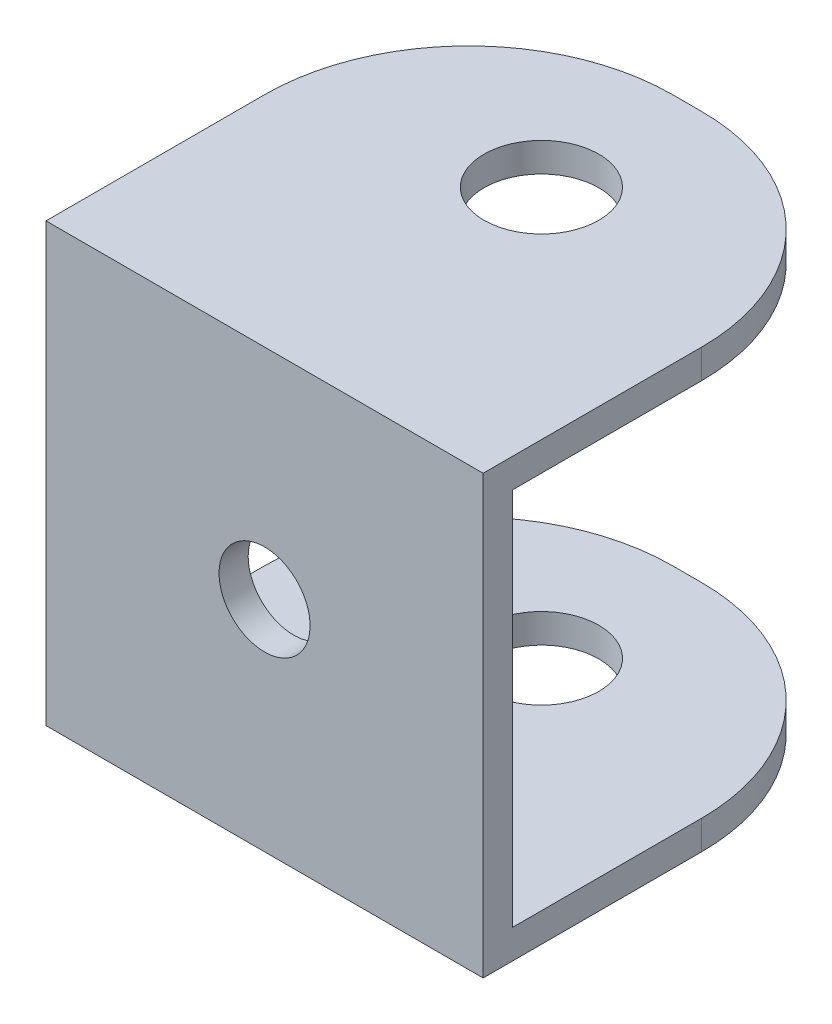
from build123d import *

# Parameters (mm, degrees)
SKETCH2_W                      = 38.1
SKETCH2_H                      = 38.1
BOSS_EXTRUDE1_DEPTH            = 2.54
F_5_16_0_3125_DIAMETER_HOLE1_D = 7.9375
BOSS_EXTRUDE2_DEPTH            = 2.54
F_10_0MM_DOWEL_HOLE1_D         = 10


with BuildPart() as part:
    # Sketch2 → Boss-Extrude1 (new body)
    with BuildSketch(Plane.XY):
        with Locations((19.05, 19.05)):
            Rectangle(SKETCH2_W, SKETCH2_H)
    boss_extrude1 = extrude(amount=BOSS_EXTRUDE1_DEPTH)

    # 5/16 (0.3125) Diameter Hole1 (through all)
    with Locations(Plane(origin=(19.05, 19.05, 0), x_dir=(-1, 0, 0), z_dir=(0, 0, -1))):
        with Locations((0, 0)):
            f_5_16_0_3125_diameter_hole1 = Hole(F_5_16_0_3125_DIAMETER_HOLE1_D / 2)

    # Sketch4 → Boss-Extrude2 (add)
    with BuildSketch(Plane(origin=(0, 38.1, 0), x_dir=(1, 0, 0), z_dir=(0, 1, 0))):
        with BuildLine():
            Line((0, 0), (0, 16.51))
            ThreePointArc((0, 16.51), (5.207641431, 29.082358569), (17.78, 34.29))
            Line((17.78, 34.29), (20.32, 34.29))
            ThreePointArc((20.32, 34.29), (32.892358569, 29.082358569), (38.1, 16.51))
            Line((38.1, 16.51), (38.1, 0))
            Line((38.1, 0), (38.1, -2.54))
            Line((38.1, -2.54), (0, -2.54))
            Line((0, -2.54), (0, 0))
        make_face()
    boss_extrude2 = extrude(amount=-BOSS_EXTRUDE2_DEPTH)

    # Ø10.0mm Dowel Hole1 (through all)
    with Locations(Plane(origin=(0, 38.1, 0), x_dir=(1, 0, 0), z_dir=(0, 1, 0))):
        with Locations((19.05, 21.59)):
            f_10_0mm_dowel_hole1 = Hole(F_10_0MM_DOWEL_HOLE1_D / 2)

    # Mirror4: Boss-Extrude1, 5/16 (0.3125) Diameter Hole1, Boss-Extrude2, Ø10.0mm Dowel Hole1 across plane
    add(boss_extrude1.mirror(Plane(origin=(0, 19.05, 0), x_dir=(0, 0, 1), z_dir=(0, -1, 0))))
    add(f_5_16_0_3125_diameter_hole1.mirror(Plane(origin=(0, 19.05, 0), x_dir=(0, 0, 1), z_dir=(0, -1, 0))), mode=Mode.SUBTRACT)
    add(boss_extrude2.mirror(Plane(origin=(0, 19.05, 0), x_dir=(0, 0, 1), z_dir=(0, -1, 0))))
    add(f_10_0mm_dowel_hole1.mirror(Plane(origin=(0, 19.05, 0), x_dir=(0, 0, 1), z_dir=(0, -1, 0))), mode=Mode.SUBTRACT)


solid = part.part
